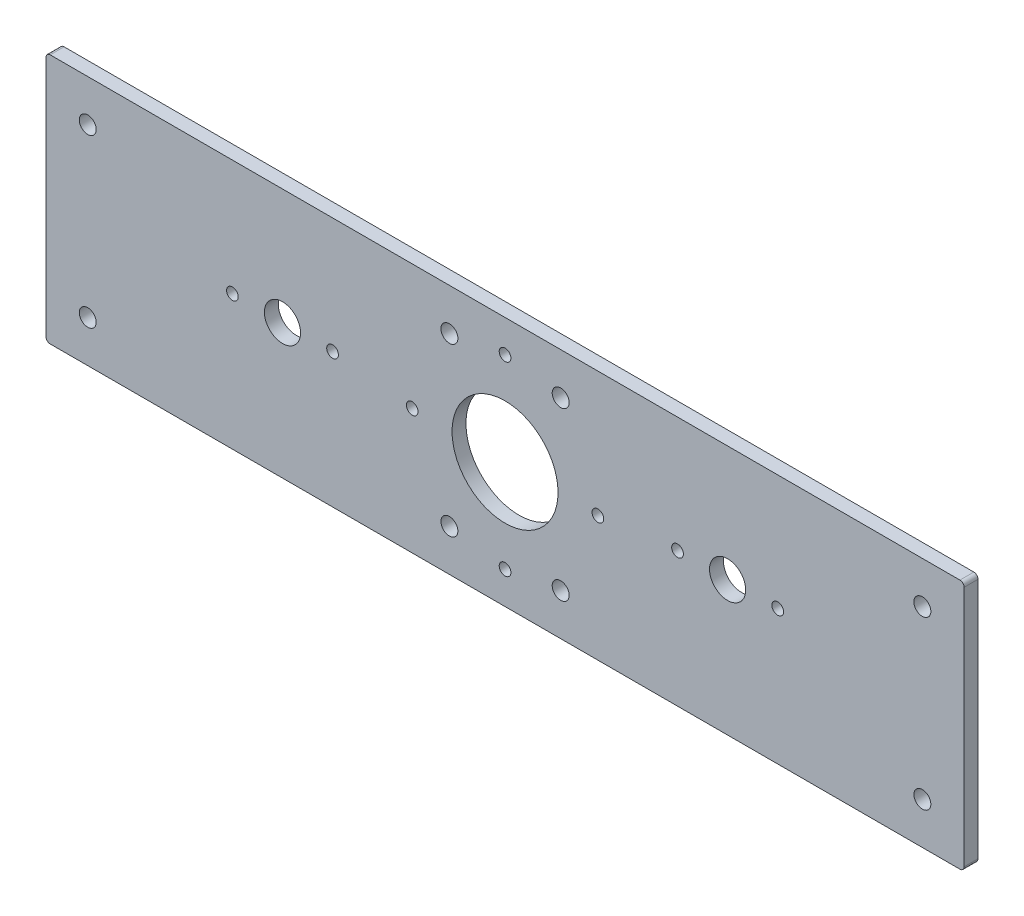
from build123d import *

# Parameters (mm, degrees)
SKETCH1_W           = 330
SKETCH1_H           = 90
SKETCH1_R           = 19.05
SKETCH1_R_2         = 2.1
BOSS_EXTRUDE1_DEPTH = 2.5
SKETCH2_R           = 3.05
CUT_EXTRUDE1_DEPTH  = 172.099386323
SKETCH3_R           = 2.1
SKETCH3_R_2         = 6.5
CUT_EXTRUDE2_DEPTH  = 172.099386323
FILLET1_R           = 1.5


with BuildPart() as part:
    # Sketch1 → Boss-Extrude1 (new, symmetric)
    with BuildSketch(Plane.XY):
        Rectangle(SKETCH1_W, SKETCH1_H)
        Circle(SKETCH1_R, mode=Mode.SUBTRACT)
        with Locations((-33.375440072, 0)):
            Circle(SKETCH1_R_2, mode=Mode.SUBTRACT)
        with Locations((33.375440072, 0)):
            Circle(SKETCH1_R_2, mode=Mode.SUBTRACT)
        with Locations((0, 33.375440072)):
            Circle(SKETCH1_R_2, mode=Mode.SUBTRACT)
        with Locations((0, -33.375440072)):
            Circle(SKETCH1_R_2, mode=Mode.SUBTRACT)
    extrude(amount=BOSS_EXTRUDE1_DEPTH, both=True)

    # Sketch2 → Cut-Extrude1 (cut, through all)
    with BuildSketch(Plane.XY.offset(2.5)):
        with Locations((-150, 30)):
            Circle(SKETCH2_R)
        with Locations((-150, -30)):
            Circle(SKETCH2_R)
        with Locations((-20, 30)):
            Circle(SKETCH2_R)
        with Locations((-20, -30)):
            Circle(SKETCH2_R)
        with Locations((20, -30)):
            Circle(SKETCH2_R)
        with Locations((20, 30)):
            Circle(SKETCH2_R)
        with Locations((150, 30)):
            Circle(SKETCH2_R)
        with Locations((150, -30)):
            Circle(SKETCH2_R)
    extrude(amount=-CUT_EXTRUDE1_DEPTH, mode=Mode.SUBTRACT)

    # Sketch3 → Cut-Extrude2 (cut, through all)
    with BuildSketch(Plane.XY.offset(2.5)):
        with Locations((-62, 3.4)):
            Circle(SKETCH3_R)
        with Locations((-98, 3.4)):
            Circle(SKETCH3_R)
        with Locations((-80, 3.4)):
            Circle(SKETCH3_R_2)
    cut_extrude2 = extrude(amount=-CUT_EXTRUDE2_DEPTH, mode=Mode.SUBTRACT)

    # Mirror1: Cut-Extrude2 across plane
    add(cut_extrude2.mirror(Plane(origin=(0, 0, 0), x_dir=(0, 0, 1), z_dir=(1, 0, 0))), mode=Mode.SUBTRACT)

    # Fillet1
    fillet1_edges = [part.edges().sort_by_distance(p)[0] for p in [
        (-165, -45, 0),
        (165, -45, 0),
        (165, 45, 0),
        (-165, 45, 0),
    ]]
    fillet(fillet1_edges, radius=FILLET1_R)


solid = part.part
